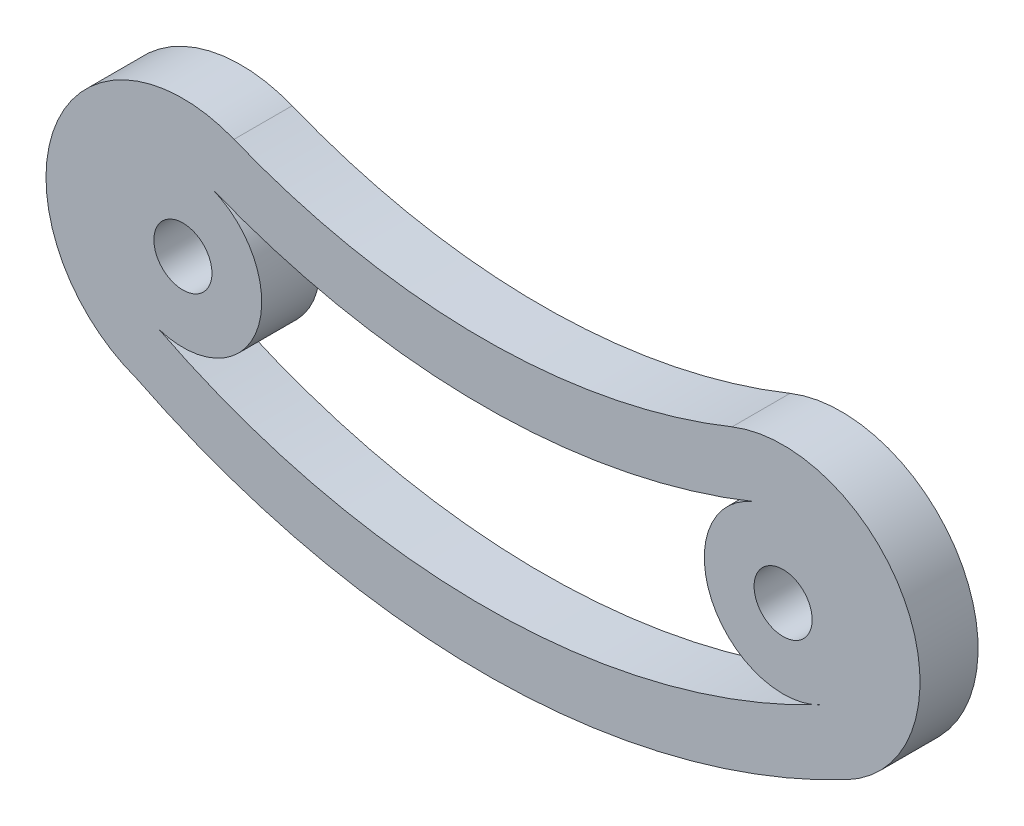
from build123d import *

# Parameters (mm, degrees)
SKETCH1_R           = 1.5
EXTRUDE1_DEPTH      = 3
BOSS_EXTRUDE2_START = -3
BOSS_EXTRUDE2_DEPTH = 3
CUT_EXTRUDE4_START  = -5
CUT_EXTRUDE4_DEPTH  = 5
BOSS_EXTRUDE3_DEPTH = 3
BOSS_EXTRUDE4_DEPTH = 3
CUT_EXTRUDE6_DEPTH  = 5


with BuildPart() as part:
    # Sketch1 → Extrude1 (new body)
    with BuildSketch(Plane.XY):
        with BuildLine():
            ThreePointArc((0, 5), (-5, 0), (0, -5))
            Line((0, -5), (31, -5))
            ThreePointArc((31, -5), (36, 0), (31, 5))
            Line((31, 5), (0, 5))
        make_face()
        Circle(SKETCH1_R, mode=Mode.SUBTRACT)
        with BuildLine():
            ThreePointArc((32.5, 0), (31, -1.5), (29.5, 0))
            ThreePointArc((29.5, 0), (31, 1.5), (32.5, 0))
        make_face(mode=Mode.SUBTRACT)
    extrude(amount=EXTRUDE1_DEPTH)

    # Sketch2 → Boss-Extrude2 (add)
    with BuildSketch(Plane.XY.offset(3).offset(BOSS_EXTRUDE2_START)):
        with BuildLine():
            Line((30.833786225, -5), (0.166213775, -5))
            ThreePointArc((0.166213775, -5), (15.5, -10), (30.833786225, -5))
        make_face()
        with BuildLine():
            ThreePointArc((36, 0), (36, 5), (31, 5))
            ThreePointArc((31, 5), (34.535533906, 3.535533906), (36, 0))
        make_face()
        with BuildLine():
            ThreePointArc((-5, 0), (-3.535533906, 3.535533906), (0, 5))
            ThreePointArc((0, 5), (-5, 5), (-5, 0))
        make_face()
    extrude(amount=BOSS_EXTRUDE2_DEPTH)

    # Sketch2<6> → Cut-Extrude4 (cut)
    with BuildSketch(Plane.XY.offset(3).offset(CUT_EXTRUDE4_START)):
        with BuildLine():
            Line((31, 5), (0, 5))
            ThreePointArc((0, 5), (15.5, -1.27314911), (31, 5))
        make_face()
        with BuildLine():
            ThreePointArc((31, -5), (34.535533906, -3.535533906), (36, 0))
            ThreePointArc((36, 0), (33.590468728, -2.679345747), (30.833786225, -5))
            Line((30.833786225, -5), (31, -5))
        make_face()
        with BuildLine():
            ThreePointArc((0.166213775, -5), (-2.590468728, -2.679345747), (-5, 0))
            ThreePointArc((-5, 0), (-3.535533906, -3.535533906), (0, -5))
            Line((0, -5), (0.166213775, -5))
        make_face()
    extrude(amount=CUT_EXTRUDE4_DEPTH, mode=Mode.SUBTRACT)

    # Sketch5 → Boss-Extrude3 (add)
    with BuildSketch(Plane(origin=(0, 0, 0), x_dir=(-1, 0, 0), z_dir=(0, 0, -1))):
        with BuildLine():
            ThreePointArc((-2.599706958, -6.575828749), (5.911032444, -3.880682343), (4.999999984, 5.000000016))
            ThreePointArc((4.999999984, 5.000000016), (6.035533906, 2.500000011), (5, 0))
            ThreePointArc((5, 0), (1.520730735, -3.658414607), (-2.599706958, -6.575828749))
        make_face()
        with BuildLine():
            ThreePointArc((0, 5), (2.499999989, 6.035533906), (4.999999984, 5.000000016))
            ThreePointArc((4.999999984, 5.000000016), (-2.526282139, 6.604384797), (-7.06048758, 0.386671862))
            ThreePointArc((-7.06048758, 0.386671862), (-3.310013829, 2.356284055), (0, 5))
        make_face()
        with BuildLine():
            ThreePointArc((-36.000000042, 4.999999958), (-36.911032421, -3.880682377), (-28.400293042, -6.575828749))
            ThreePointArc((-28.400293042, -6.575828749), (-32.520730735, -3.658414607), (-36, 0))
            ThreePointArc((-36, 0), (-37.035533906, 2.499999971), (-36.000000042, 4.999999958))
        make_face()
        with BuildLine():
            ThreePointArc((-31, 5), (-27.689986171, 2.356284055), (-23.93951242, 0.386671862))
            ThreePointArc((-23.93951242, 0.386671862), (-28.473717899, 6.604384812), (-36.000000042, 4.999999958))
            ThreePointArc((-36.000000042, 4.999999958), (-33.500000029, 6.035533906), (-31, 5))
        make_face()
    extrude(amount=-BOSS_EXTRUDE3_DEPTH)

    # Sketch6 → Boss-Extrude4 (add)
    with BuildSketch(Plane(origin=(0, 0, 0), x_dir=(-1, 0, 0), z_dir=(0, 0, -1))):
        with BuildLine():
            ThreePointArc((-7.06048758, 0.386671862), (-5.748903613, 4.117050795), (-2.639524867, 6.559947292))
            ThreePointArc((-2.639524867, 6.559947292), (-15.5, 4.069630639), (-28.360475133, 6.559947292))
            ThreePointArc((-28.360475133, 6.559947292), (-25.251096387, 4.117050795), (-23.93951242, 0.386671862))
            ThreePointArc((-23.93951242, 0.386671862), (-15.5, -1.27314911), (-7.06048758, 0.386671862))
        make_face()
        with BuildLine():
            ThreePointArc((-34.288674296, -6.259762086), (-15.993644495, -10.877173454), (2.396097668, -6.652722448))
            ThreePointArc((2.396097668, -6.652722448), (-0.108822543, -7.070230382), (-2.599706958, -6.575828749))
            ThreePointArc((-2.599706958, -6.575828749), (-15.5, -10), (-28.400293042, -6.575828749))
            ThreePointArc((-28.400293042, -6.575828749), (-31.379003341, -7.060903375), (-34.288674296, -6.259762086))
        make_face()
    extrude(amount=-BOSS_EXTRUDE4_DEPTH)

    # Sketch7 → Cut-Extrude6 (cut)
    with BuildSketch(Plane(origin=(0, 0, 0), x_dir=(-1, 0, 0), z_dir=(0, 0, -1))):
        with BuildLine():
            ThreePointArc((-29.480330692, 3.776797363), (-27.626554437, 2.278916006), (-26.928932188, 0))
            ThreePointArc((-26.928932188, 0), (-28.894602064, -3.484378375), (-32.893407958, -3.603969954))
            ThreePointArc((-32.893407958, -3.603969954), (-15.863554262, -7.878266077), (1.233165938, -3.879806039))
            ThreePointArc((1.233165938, -3.879806039), (-3.83098094, -1.377380909), (-1.519669308, 3.776797363))
            ThreePointArc((-1.519669308, 3.776797363), (-15.5, 1.069630639), (-29.480330692, 3.776797363))
        make_face()
    extrude(amount=-CUT_EXTRUDE6_DEPTH, mode=Mode.SUBTRACT)


solid = part.part
